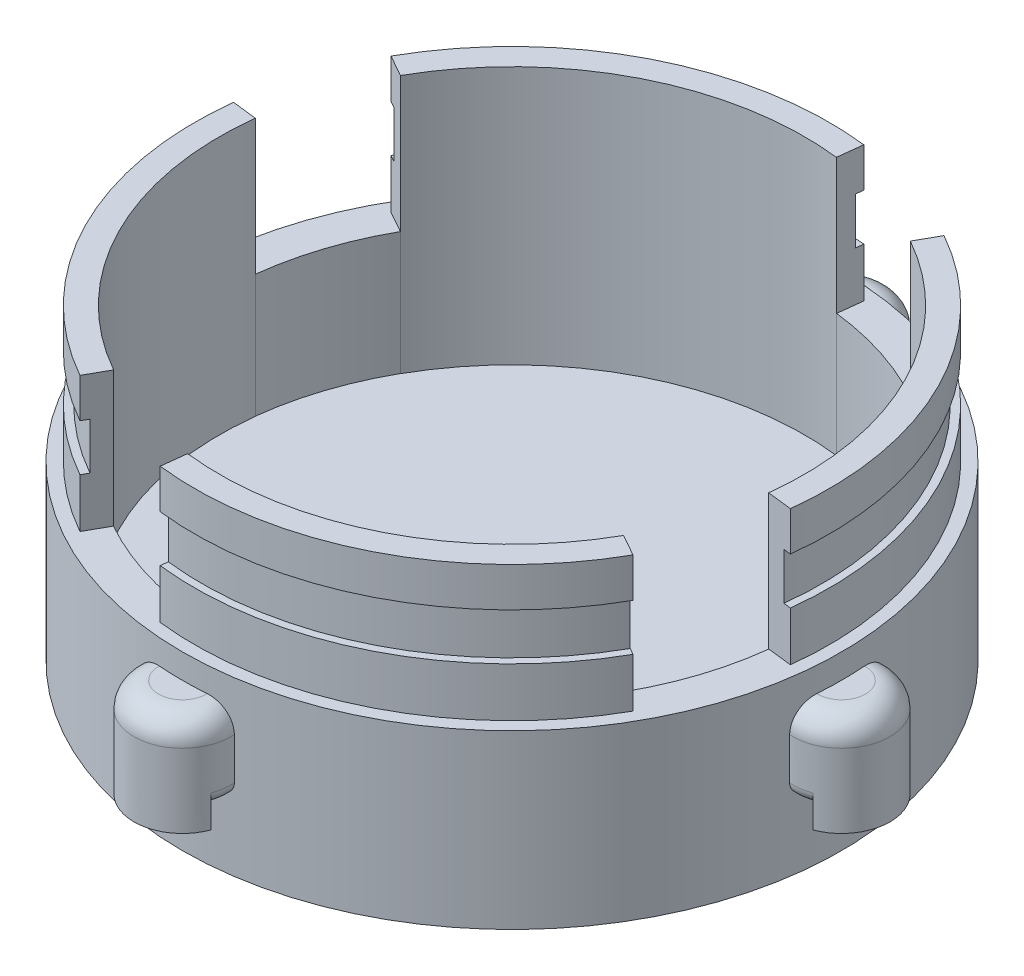
from build123d import *

# Parameters (mm, degrees)
SKETCH3_R             = 34.036
SKETCH3_R_2           = 30.226
BOSS_EXTRUDE2_DEPTH   = 12.7
BOSS_EXTRUDE6_DEPTH   = 26.67
BOSS_EXTRUDE6_2_DEPTH = 26.67
BOSS_EXTRUDE6_3_DEPTH = 26.67
BOSS_EXTRUDE6_4_DEPTH = 26.67
CUT_EXTRUDE2_START    = 17.78
SKETCH7_R             = 34.036
SKETCH7_R_2           = 32.004
CUT_EXTRUDE2_DEPTH    = 4.826
BOSS_EXTRUDE7_START   = -5.08
SKETCH8_R             = 34.036
SKETCH8_R_2           = 5
BOSS_EXTRUDE7_DEPTH   = 5.08
BOSS_EXTRUDE8_DEPTH   = 10.16
FILLET1_R             = 2.54
SKETCH11_R            = 36.068
SKETCH11_R_2          = 34.036
CUT_EXTRUDE3_DEPTH    = 2.032
FILLET2_R             = 1.27


with BuildPart() as part:
    # Sketch3 → Boss-Extrude2 (new body)
    with BuildSketch(Plane(origin=(0, 0, 0), x_dir=(1, 0, 0), z_dir=(0, 1, 0))):
        Circle(SKETCH3_R)
        Circle(SKETCH3_R_2, mode=Mode.SUBTRACT)
    extrude(amount=BOSS_EXTRUDE2_DEPTH)



with BuildPart() as body_2:
    # Sketch5 → Boss-Extrude6 (new body)
    with BuildSketch(Plane(origin=(0, 0, 0), x_dir=(1, 0, 0), z_dir=(0, 1, 0))):
        with BuildLine():
            ThreePointArc((-3.792010539, -32.545835557), (14.875452714, -29.194719772), (28.559021933, -16.062161195))
            Line((28.559021933, -16.062161195), (26.330368575, -14.80872228))
            ThreePointArc((26.330368575, -14.80872228), (13.713740726, -26.916906957), (-3.498056233, -30.005835557))
            Line((-3.498056233, -30.005835557), (-3.792010539, -32.545835557))
        make_face()
    extrude(amount=BOSS_EXTRUDE6_DEPTH)


with BuildPart() as body_3:
    # Sketch5 → Boss-Extrude6 2 (new body)
    with BuildSketch(Plane(origin=(0, 0, 0), x_dir=(1, 0, 0), z_dir=(0, 1, 0))):
        with BuildLine():
            ThreePointArc((-32.545835557, 3.792010539), (-29.194719772, -14.875452714), (-16.062161195, -28.559021933))
            Line((-16.062161195, -28.559021933), (-14.80872228, -26.330368575))
            ThreePointArc((-14.80872228, -26.330368575), (-26.916906957, -13.713740726), (-30.005835557, 3.498056233))
            Line((-30.005835557, 3.498056233), (-32.545835557, 3.792010539))
        make_face()
    extrude(amount=BOSS_EXTRUDE6_2_DEPTH)


with BuildPart() as body_4:
    # Sketch5 → Boss-Extrude6 3 (new body)
    with BuildSketch(Plane(origin=(0, 0, 0), x_dir=(1, 0, 0), z_dir=(0, 1, 0))):
        with BuildLine():
            ThreePointArc((3.792010539, 32.545835557), (-14.875452714, 29.194719772), (-28.559021933, 16.062161195))
            Line((-28.559021933, 16.062161195), (-26.330368575, 14.80872228))
            ThreePointArc((-26.330368575, 14.80872228), (-13.713740726, 26.916906957), (3.498056233, 30.005835557))
            Line((3.498056233, 30.005835557), (3.792010539, 32.545835557))
        make_face()
    extrude(amount=BOSS_EXTRUDE6_3_DEPTH)


with BuildPart() as body_5:
    # Sketch5 → Boss-Extrude6 4 (new body)
    with BuildSketch(Plane(origin=(0, 0, 0), x_dir=(1, 0, 0), z_dir=(0, 1, 0))):
        with BuildLine():
            ThreePointArc((14.80872228, 26.330368575), (26.916906957, 13.713740726), (30.005835557, -3.498056233))
            Line((30.005835557, -3.498056233), (32.545835557, -3.792010539))
            ThreePointArc((32.545835557, -3.792010539), (29.194719772, 14.875452714), (16.062161195, 28.559021933))
            Line((16.062161195, 28.559021933), (14.80872228, 26.330368575))
        make_face()
    extrude(amount=BOSS_EXTRUDE6_4_DEPTH)


with BuildPart() as cut_extrude2_tool:
    # Sketch7 → Cut-Extrude2 (new body)
    with BuildSketch(Plane(origin=(0, 0, 0), x_dir=(1, 0, 0), z_dir=(0, 1, 0)).offset(CUT_EXTRUDE2_START)):
        Circle(SKETCH7_R)
        Circle(SKETCH7_R_2, mode=Mode.SUBTRACT)
    extrude(amount=CUT_EXTRUDE2_DEPTH)


with BuildPart() as body_2_1:
    add(body_2.part)

    # Cut-Extrude2: cut by cut_extrude2_tool
    add(cut_extrude2_tool.part, mode=Mode.SUBTRACT)


with BuildPart() as body_3_1:
    add(body_3.part)

    # Cut-Extrude2: cut by cut_extrude2_tool
    add(cut_extrude2_tool.part, mode=Mode.SUBTRACT)


with BuildPart() as body_4_1:
    add(body_4.part)

    # Cut-Extrude2: cut by cut_extrude2_tool
    add(cut_extrude2_tool.part, mode=Mode.SUBTRACT)


with BuildPart() as body_5_1:
    add(body_5.part)

    # Cut-Extrude2: cut by cut_extrude2_tool
    add(cut_extrude2_tool.part, mode=Mode.SUBTRACT)


with BuildPart() as part_1:
    add(part.part)

    add(body_2_1.part)  # Boss-Extrude7 merges body 2

    add(body_3_1.part)  # Boss-Extrude7 merges body 3

    add(body_4_1.part)  # Boss-Extrude7 merges body 4

    add(body_5_1.part)  # Boss-Extrude7 merges body 5
    # Sketch8 → Boss-Extrude7 (add)
    with BuildSketch(Plane(origin=(0, 0, 0), x_dir=(1, 0, 0), z_dir=(0, 1, 0)).offset(BOSS_EXTRUDE7_START)):
        Circle(SKETCH8_R)
        Circle(SKETCH8_R_2, mode=Mode.SUBTRACT)
    extrude(amount=BOSS_EXTRUDE7_DEPTH)

    # Sketch10 → Boss-Extrude8 (add)
    with BuildSketch(Plane(origin=(0, 0, 0), x_dir=(1, 0, 0), z_dir=(0, 1, 0))):
        with BuildLine():
            ThreePointArc((33.667981618, 4.991623958), (34.036, 0), (33.667981618, -4.991623958))
            ThreePointArc((33.667981618, -4.991623958), (39.041172052, 0), (33.667981618, 4.991623958))
        make_face()
        with BuildLine():
            ThreePointArc((-4.991623958, 33.667981618), (0, 34.036), (4.991623958, 33.667981618))
            ThreePointArc((4.991623958, 33.667981618), (0, 39.041172052), (-4.991623958, 33.667981618))
        make_face()
        with BuildLine():
            ThreePointArc((-4.991623958, -33.667981618), (0, -39.041172052), (4.991623958, -33.667981618))
            ThreePointArc((4.991623958, -33.667981618), (0, -34.036), (-4.991623958, -33.667981618))
        make_face()
        with BuildLine():
            ThreePointArc((-33.667981618, -4.991623958), (-34.036, 0), (-33.667981618, 4.991623958))
            ThreePointArc((-33.667981618, 4.991623958), (-39.041172052, 0), (-33.667981618, -4.991623958))
        make_face()
    extrude(amount=BOSS_EXTRUDE8_DEPTH)

    # Fillet1
    fillet1_edges = [part_1.edges().sort_by_distance(p)[0] for p in [
        (39.041172052, 10.16, 0),
        (0, 10.16, -39.041172052),
        (-39.041172052, 10.16, 0),
        (0, 10.16, 39.041172052),
    ]]
    fillet(fillet1_edges, radius=FILLET1_R)

    # Sketch11 → Cut-Extrude3 (cut)
    with BuildSketch(Plane(origin=(0, 0, 0), x_dir=(1, 0, 0), z_dir=(0, 1, 0))):
        Circle(SKETCH11_R)
        Circle(SKETCH11_R_2, mode=Mode.SUBTRACT)
    extrude(amount=CUT_EXTRUDE3_DEPTH, mode=Mode.SUBTRACT)

    # Fillet2
    fillet2_edges = [part_1.edges().sort_by_distance(p)[0] for p in [
        (-4.956832185, 2.032, -34.729946651),
        (4.956832185, 2.032, -34.729946651),
        (-34.729946651, 2.032, 4.956832185),
        (-34.729946651, 2.032, -4.956832185),
        (4.956832185, 2.032, 34.729946651),
        (-4.956832185, 2.032, 34.729946651),
        (34.729946651, 2.032, 4.956832185),
        (34.729946651, 2.032, -4.956832185),
    ]]
    fillet(fillet2_edges, radius=FILLET2_R)


solid = part_1.part
